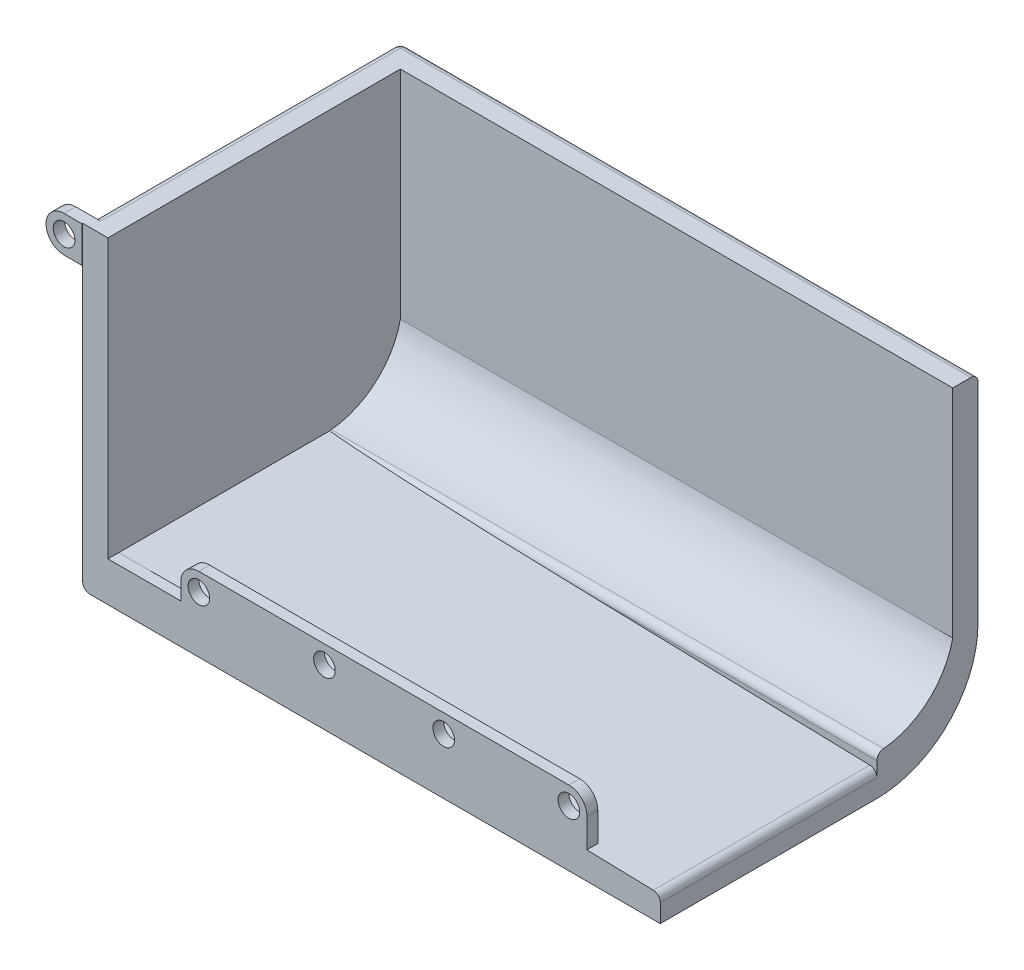
from build123d import *

# Parameters (mm, degrees)
BOSS_EXTRUDE1_DEPTH      = 203.2
CUT_EXTRUDE1_DEPTH       = 194.31
CUT_EXTRUDE2_DEPTH       = 76.2
FILLET1_R                = 2.54
SKETCH8_R                = 3.793541353
BOSS_EXTRUDE2_DEPTH      = 3.81
BOSS_EXTRUDE3_DEPTH      = 0.254
BOSS_EXTRUDE3_DEPTH_BACK = 3.81
SKETCH9_R                = 3.815492591
FILLET2_R                = 2.54
FILLET4_R                = 2.54
FILLET5_R                = 2.54


with BuildPart() as part:
    # Sketch1 → Boss-Extrude1 (new body)
    with BuildSketch(Plane(origin=(0, 0, 0), x_dir=(0, 0, -1), z_dir=(1, 0, 0))):
        with BuildLine():
            Line((25.4, 0), (25.4, -10.16))
            Line((25.4, -10.16), (101.6, -10.16))
            ThreePointArc((101.6, -10.16), (126.744717139, 0.255282861), (137.16, 25.4))
            Line((137.16, 25.4), (137.16, 101.6))
            Line((137.16, 101.6), (127, 101.6))
            Line((127, 101.6), (25.4, 101.6))
            Line((25.4, 101.6), (25.4, 0))
        make_face()
    extrude(amount=BOSS_EXTRUDE1_DEPTH)

    # Sketch4 → Cut-Extrude1 (cut)
    with BuildSketch(Plane(origin=(203.2, 0, 0), x_dir=(0, 0, -1), z_dir=(1, 0, 0))):
        with BuildLine():
            Line((25.4, 3.81), (101.6, 3.81))
            ThreePointArc((101.6, 3.81), (118.756755229, 9.884008246), (128.27, 25.4))
            Line((128.27, 25.4), (128.27, 101.6))
            Line((128.27, 101.6), (25.4, 101.6))
            Line((25.4, 101.6), (25.4, 3.81))
        make_face()
    extrude(amount=-CUT_EXTRUDE1_DEPTH, mode=Mode.SUBTRACT)

    # Sketch5 → Cut-Extrude2 (cut)
    with BuildSketch(Plane.XY.offset(-25.4)):
        Polygon((203.2, 3.81), (8.89, 3.81), (203.2, -1.27), align=None)
    extrude(amount=-CUT_EXTRUDE2_DEPTH, mode=Mode.SUBTRACT)

    # Fillet1
    # the kernel refuses this fillet: 2.54 mm, written as the material it takes off along each edge
    with BuildSketch(Plane(origin=(209.278955694, 3.81, -101.6), x_dir=(0, -1, 0), z_dir=(-1, 0, 0))) as fillet1_piece_1_section:
        with BuildLine():
            CenterArc((2.431582278, -2.54), FILLET1_R, 90, 85.111724817)
            ThreePointArc((-0.099179119, -2.323558897), (-0.024806063, -1.162837311), (0, 0))
            Line((0, 0), (2.431582278, 0))
        make_face()
    fillet1_piece_1 = extrude(amount=200.388955694, mode=Mode.PRIVATE)
    fillet1_piece_1 = split(fillet1_piece_1, bisect_by=Plane(origin=(118.388821379, 0.947285716, -102.156943798), z_dir=(0.02613486081539205, 0.9996584261887458, 0)), keep=Keep.TOP, mode=Mode.PRIVATE)
    add(fillet1_piece_1, mode=Mode.SUBTRACT)

    # Sketch8 → Boss-Extrude2 (add)
    with BuildSketch(Plane.XY.offset(-25.4)):
        with BuildLine():
            Line((34.518861263, 3.823081405), (8.89, 3.81))
            Line((8.89, 3.81), (177.388856757, -0.595198869))
            Line((177.388856757, -0.595198869), (177.388856757, 9.645912611))
            ThreePointArc((177.388856757, 9.645912611), (175.528984934, 14.136040391), (171.038857154, 15.995912214))
            Line((171.038857154, 15.995912214), (40.868860866, 15.995912214))
            ThreePointArc((40.868860866, 15.995912214), (36.378733086, 14.136040391), (34.518861263, 9.645912611))
            Line((34.518861263, 9.645912611), (34.518861263, 3.823081405))
        make_face()
        with Locations((127.001989144, 9.496635092)):
            Circle(SKETCH8_R, mode=Mode.SUBTRACT)
        with Locations((171.038857154, 9.645912611)):
            Circle(SKETCH8_R, mode=Mode.SUBTRACT)
        with Locations((40.868860866, 9.645912611)):
            Circle(SKETCH8_R, mode=Mode.SUBTRACT)
        with Locations((85.055006395, 9.645912611)):
            Circle(SKETCH8_R, mode=Mode.SUBTRACT)
    extrude(amount=-BOSS_EXTRUDE2_DEPTH)

    # Sketch9 → Boss-Extrude3 (add, two sides: drawn at the far end of the back side and taken through both)
    with BuildSketch(Plane.XY.offset(-25.4).offset(-BOSS_EXTRUDE3_DEPTH_BACK)):
        with BuildLine():
            Line((0, 96.077095974), (0, 101.6))
            Line((0, 101.6), (-6.295904403, 101.6))
            ThreePointArc((-6.295904403, 101.6), (-12.645904403, 95.25), (-6.295904403, 88.9))
            Line((-6.295904403, 88.9), (0, 88.9))
            Line((0, 88.9), (0, 94.422904026))
            Line((0, 94.422904026), (0, 96.077095974))
        make_face()
        with Locations((-6.295904403, 95.25)):
            Circle(SKETCH9_R, mode=Mode.SUBTRACT)
    extrude(amount=BOSS_EXTRUDE3_DEPTH + BOSS_EXTRUDE3_DEPTH_BACK)

    # Fillet2
    fillet2_edges = [part.edges().sort_by_distance(p)[0] for p in [
        (101.6, 101.6, -137.16),
    ]]
    fillet(fillet2_edges, radius=FILLET2_R)

    # Fillet4
    fillet4_edges = [part.edges().sort_by_distance(p)[0] for p in [
        (203.2, -1.27, -63.5),
    ]]
    fillet(fillet4_edges, radius=FILLET4_R)

    # Fillet5
    fillet5_edges = [part.edges().sort_by_distance(p)[0] for p in [
        (0, 101.6, -81.915),
        (0, 100.856051224, -136.416051224),
        (0, 62.23, -137.16),
        (0, 0.255282861, -126.744717139),
        (0, -10.16, -63.5),
    ]]
    fillet(fillet5_edges, radius=FILLET5_R)


solid = part.part
